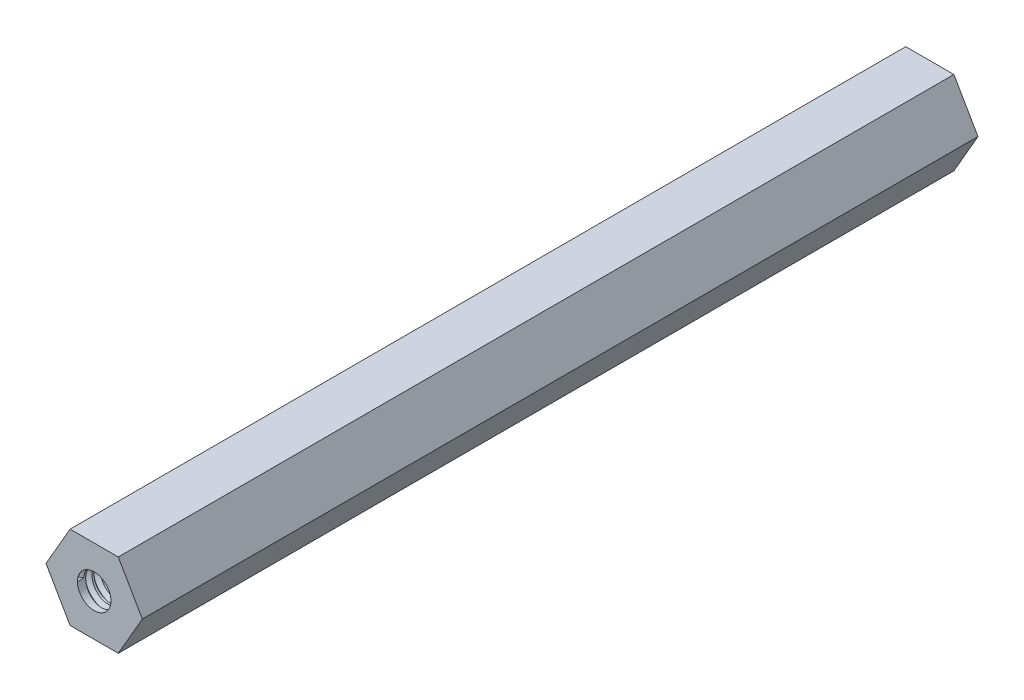
from build123d import *
from build123d.topology import SkipClean

# Parameters (mm, degrees)
EXTRUSI_N_HEX_PROFILE_DEPTH = 63.585499956
TAP_START                   = 63.5855
CROQUIS3_R                  = 2.5527
TAP_HOLE_1_DEPTH            = 19.05
TAP_START_2                 = -44.5355
CROQUIS3_3_R                = 2.5527
TAP_HOLE_2_DEPTH            = 19.05
ROSCA1_PITCH                = 1.27
ROSCA2_PITCH                = 1.27


with BuildPart() as part:
    # Croquis2 → Extrusión Hex Profile (new, symmetric)
    with BuildSketch(Plane.XY):
        Polygon((3.666174209, -6.35), (7.332348419, 0), (3.666174209, 6.35), (-3.666174209, 6.35), (-7.332348419, 0), (-3.666174209, -6.35), align=None)
    extrude(amount=EXTRUSI_N_HEX_PROFILE_DEPTH, both=True)

    # Croquis3 → Tap Hole 1 (cut)
    with BuildSketch(Plane.XY.offset(TAP_START)):
        Circle(CROQUIS3_R)
    extrude(amount=-TAP_HOLE_1_DEPTH, mode=Mode.SUBTRACT)

    # Croquis3<3> → Tap Hole 2 (cut)
    with BuildSketch(Plane.XY.offset(TAP_START_2)):
        Circle(CROQUIS3_3_R)
    extrude(amount=-TAP_HOLE_2_DEPTH, mode=Mode.SUBTRACT)

    # Rosca1: the profile of Perfil de rosca1 profile screwed along a right-hand helix of 15 turns, 8 arcs to a turn; built about Z, then put on its axis
    rosca1_z = Axis((0, 0, 0), (0, 0, 1))
    rosca1_corners = [(2.5524, 0, -0.000173205), (3.240107661, 0, 0.396874998), (3.240107661, 0, 0.555624998), (2.5524, 0, 0.952673202)]
    with BuildLine(mode=Mode.PRIVATE) as rosca1_profile:
        Line(rosca1_corners[0], rosca1_corners[1])
        Line(rosca1_corners[1], rosca1_corners[2])
        Line(rosca1_corners[2], rosca1_corners[3])
        Line(rosca1_corners[3], rosca1_corners[0])
    rosca1_cap = Face(rosca1_profile.wire())
    rosca1_turn_angles = [0, 22.5, 45, 67.5, 90, 112.5, 135, 157.5, 180, 202.5, 225, 247.5, 270, 292.5, 315, 337.5, 360]
    rosca1_turn_weights = [1, 0.9238795325112867, 1, 0.9238795325112867, 1, 0.9238795325112867, 1, 0.9238795325112867, 1, 0.9238795325112867, 1, 0.9238795325112867, 1, 0.9238795325112867, 1, 0.9238795325112867, 1]
    rosca1_turn_rails = [Edge.make_bspline([Vector(p[0], p[1], 0).rotate(rosca1_z, rosca1_turn_angles[k]) / rosca1_turn_weights[k] + Vector(0, 0, p[2] + ROSCA1_PITCH * rosca1_turn_angles[k] / 360) for k in range(17)], [0, 0, 0, 1, 1, 2, 2, 3, 3, 4, 4, 5, 5, 6, 6, 7, 7, 8, 8, 8], 2, rosca1_turn_weights) for p in rosca1_corners]
    rosca1_turn_sides = [Face.make_surface_from_curves(rosca1_turn_rails[p[0]], rosca1_turn_rails[p[1]]) for p in [(0, 1), (1, 2), (2, 3), (3, 0)]]
    rosca1 = Plane(origin=(0, 0, -63.585499956), x_dir=(1, 0, 0), z_dir=(0, 0, 1)) * Solid(Shell([*[p.moved(Location((0, 0, ROSCA1_PITCH * i))) for i in range(15) for p in rosca1_turn_sides], rosca1_cap, rosca1_cap.rotate(rosca1_z, 5400).moved(Location((0, 0, ROSCA1_PITCH * 5400 / 360)))]))
    add(rosca1, mode=Mode.SUBTRACT)

    # Rosca2: the profile of Perfil de rosca2 profile screwed along a right-hand helix of 15 turns, 8 arcs to a turn; built about Z, then put on its axis
    with SkipClean():  # the faces are left unmerged after this step: merging them gives an invalid solid
        rosca2_z = Axis((0, 0, 0), (0, 0, 1))
        rosca2_corners = [(2.5524, 0, -0.000173205), (3.240107661, 0, 0.396874998), (3.240107661, 0, 0.555624998), (2.5524, 0, 0.952673202)]
        with BuildLine(mode=Mode.PRIVATE) as rosca2_profile:
            Line(rosca2_corners[0], rosca2_corners[1])
            Line(rosca2_corners[1], rosca2_corners[2])
            Line(rosca2_corners[2], rosca2_corners[3])
            Line(rosca2_corners[3], rosca2_corners[0])
        rosca2_cap = Face(rosca2_profile.wire())
        rosca2_turn_angles = [0, 22.5, 45, 67.5, 90, 112.5, 135, 157.5, 180, 202.5, 225, 247.5, 270, 292.5, 315, 337.5, 360]
        rosca2_turn_weights = [1, 0.9238795325112867, 1, 0.9238795325112867, 1, 0.9238795325112867, 1, 0.9238795325112867, 1, 0.9238795325112867, 1, 0.9238795325112867, 1, 0.9238795325112867, 1, 0.9238795325112867, 1]
        rosca2_turn_rails = [Edge.make_bspline([Vector(p[0], p[1], 0).rotate(rosca2_z, rosca2_turn_angles[k]) / rosca2_turn_weights[k] + Vector(0, 0, p[2] + ROSCA2_PITCH * rosca2_turn_angles[k] / 360) for k in range(17)], [0, 0, 0, 1, 1, 2, 2, 3, 3, 4, 4, 5, 5, 6, 6, 7, 7, 8, 8, 8], 2, rosca2_turn_weights) for p in rosca2_corners]
        rosca2_turn_sides = [Face.make_surface_from_curves(rosca2_turn_rails[p[0]], rosca2_turn_rails[p[1]]) for p in [(0, 1), (1, 2), (2, 3), (3, 0)]]
        rosca2 = Plane(origin=(0, 0, 63.585499956), x_dir=(-1, 0, 0), z_dir=(0, 0, -1)) * Solid(Shell([*[p.moved(Location((0, 0, ROSCA2_PITCH * i))) for i in range(15) for p in rosca2_turn_sides], rosca2_cap, rosca2_cap.rotate(rosca2_z, 5400).moved(Location((0, 0, ROSCA2_PITCH * 5400 / 360)))]))
        add(rosca2, mode=Mode.SUBTRACT)


solid = part.part
